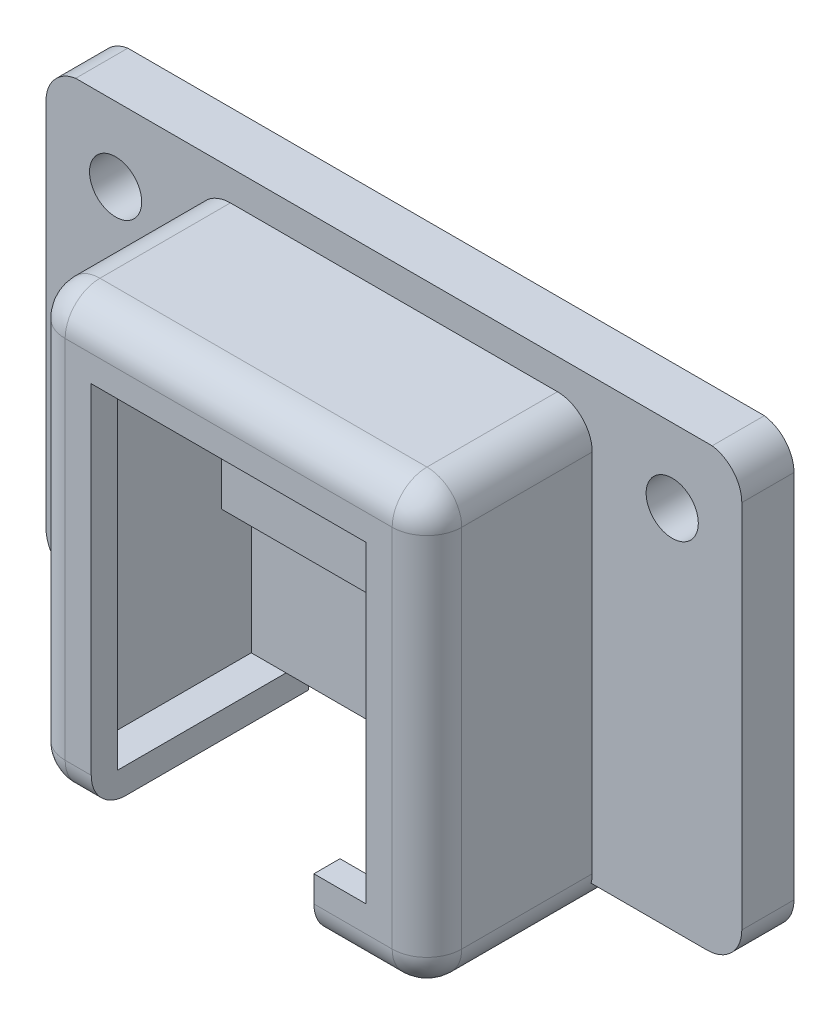
from build123d import *

# Parameters (mm, degrees)
CROQUIS1_R              = 1.5
SALIENTE_EXTRUIR1_DEPTH = 3
SALIENTE_EXTRUIR2_DEPTH = 8
CROQUIS3_W              = 13
CROQUIS3_H              = 1.7
CORTAR_EXTRUIR1_DEPTH   = 8
CROQUIS5_W              = 3.5
CROQUIS5_H              = 11
CROQUIS5_W_2            = 6.5
SALIENTE_EXTRUIR3_DEPTH = 1.5
SALIENTE_EXTRUIR4_DEPTH = 1.5
REDONDEO1_R             = 2


with BuildPart() as part:
    # Croquis1 → Saliente-Extruir1 (new body)
    with BuildSketch(Plane.XY):
        with BuildLine():
            Line((-75.306602598, 17.959617496), (-75.306602598, -5.318007663))
            Line((-75.306602598, -5.318007663), (-35.306602598, -5.318007663))
            Line((-35.306602598, -5.318007663), (-35.306602598, 17.959617496))
            ThreePointArc((-35.306602598, 17.959617496), (-35.791122177, 19.26473017), (-37.009921692, 19.937490201))
            Line((-37.009921692, 19.937490201), (-73.603283504, 19.937490201))
            ThreePointArc((-73.603283504, 19.937490201), (-74.822083019, 19.26473017), (-75.306602598, 17.959617496))
        make_face()
        with Locations((-71.306602598, 15.681992337)):
            Circle(CROQUIS1_R, mode=Mode.SUBTRACT)
        with Locations((-39.306602598, 15.681992337)):
            Circle(CROQUIS1_R, mode=Mode.SUBTRACT)
    extrude(amount=SALIENTE_EXTRUIR1_DEPTH)

    # Croquis2 → Saliente-Extruir2 (add)
    with BuildSketch(Plane.XY.offset(3)):
        Polygon((-66.706602598, -5.318007663), (-65.206602598, -5.318007663), (-65.206602598, 16.681992337), (-45.406602598, 16.681992337), (-45.406602598, -5.318007663), (-43.906602598, -5.318007663), (-43.906602598, 18.181992337), (-66.706602598, 18.181992337), align=None)
    extrude(amount=SALIENTE_EXTRUIR2_DEPTH)

    # Croquis3 → Cortar-Extruir1 (cut)
    with BuildSketch(Plane.XZ.offset(5.318007663)):
        with Locations((-58.706602598, 2.15)):
            Rectangle(CROQUIS3_W, CROQUIS3_H)
    extrude(amount=-CORTAR_EXTRUIR1_DEPTH, mode=Mode.SUBTRACT)

    # Croquis5 → Saliente-Extruir3 (add)
    with BuildSketch(Plane.XZ.offset(5.318007663)):
        with Locations((-64.956602598, 5.5)):
            Rectangle(CROQUIS5_W, CROQUIS5_H)
        with Locations((-47.156602598, 5.5)):
            Rectangle(CROQUIS5_W_2, CROQUIS5_H)
    extrude(amount=SALIENTE_EXTRUIR3_DEPTH)

    # Croquis6 → Saliente-Extruir4 (add)
    with BuildSketch(Plane.XY.offset(11)):
        Polygon((-63.206602598, -5.318007663), (-63.206602598, -6.818007663), (-66.706602598, -6.818007663), (-66.706602598, 18.181992337), (-43.906602598, 18.181992337), (-43.906602598, -6.818007663), (-50.406602598, -6.818007663), (-50.406602598, -3.318007663), (-47.406602598, -3.318007663), (-47.406602598, 14.681992337), (-63.206602598, 14.681992337), align=None)
    extrude(amount=SALIENTE_EXTRUIR4_DEPTH)

    # Redondeo1
    # the kernel refuses this fillet: 2 mm, written as the material it takes off along each edge
    with BuildSketch(Plane(origin=(-45.906602598, -4.818007663, 10.5), x_dir=(1, 0, 0), z_dir=(0, 0, 1))) as redondeo1_piece_1_section:
        Polygon((0, 0), (REDONDEO1_R * 1.02, 0), (REDONDEO1_R * 1.02, -REDONDEO1_R * 1.02), (0, -REDONDEO1_R * 1.02), align=None)
    redondeo1_piece_1 = extrude(amount=REDONDEO1_R * 1.02, mode=Mode.PRIVATE)
    redondeo1_piece_1 = redondeo1_piece_1 - Plane(origin=(-45.906602598, -4.818007663, 10.5), x_dir=(-0.7071067811865477, 0.7071067811865474, 0), z_dir=(0, 0, 1)) * Sphere(REDONDEO1_R, mode=Mode.PRIVATE)
    add(redondeo1_piece_1, mode=Mode.SUBTRACT)
    with BuildSketch(Plane(origin=(-45.906602598, 16.181992337, 10.5), x_dir=(0, 1, 0), z_dir=(0, 0, 1))) as redondeo1_piece_2_section:
        Polygon((0, 0), (REDONDEO1_R * 1.02, 0), (REDONDEO1_R * 1.02, -REDONDEO1_R * 1.02), (0, -REDONDEO1_R * 1.02), align=None)
    redondeo1_piece_2 = extrude(amount=REDONDEO1_R * 1.02, mode=Mode.PRIVATE)
    redondeo1_piece_2 = redondeo1_piece_2 - Plane(origin=(-45.906602598, 16.181992337, 10.5), x_dir=(-0.7071067811865471, -0.7071067811865477, 0), z_dir=(0, 0, 1)) * Sphere(REDONDEO1_R, mode=Mode.PRIVATE)
    add(redondeo1_piece_2, mode=Mode.SUBTRACT)
    with BuildSketch(Plane(origin=(-64.706602598, 16.181992337, 10.5), x_dir=(0, 1, 0), z_dir=(0, 0, 1))) as redondeo1_piece_3_section:
        Polygon((0, 0), (REDONDEO1_R * 1.02, 0), (REDONDEO1_R * 1.02, REDONDEO1_R * 1.02), (0, REDONDEO1_R * 1.02), align=None)
    redondeo1_piece_3 = extrude(amount=REDONDEO1_R * 1.02, mode=Mode.PRIVATE)
    redondeo1_piece_3 = redondeo1_piece_3 - Plane(origin=(-64.706602598, 16.181992337, 10.5), x_dir=(0.7071067811865477, -0.7071067811865475, 0), z_dir=(0, 0, 1)) * Sphere(REDONDEO1_R, mode=Mode.PRIVATE)
    add(redondeo1_piece_3, mode=Mode.SUBTRACT)
    with BuildSketch(Plane(origin=(-64.706602598, -4.818007663, 10.5), x_dir=(-1, 0, 0), z_dir=(0, 0, 1))) as redondeo1_piece_4_section:
        Polygon((0, 0), (REDONDEO1_R * 1.02, 0), (REDONDEO1_R * 1.02, REDONDEO1_R * 1.02), (0, REDONDEO1_R * 1.02), align=None)
    redondeo1_piece_4 = extrude(amount=REDONDEO1_R * 1.02, mode=Mode.PRIVATE)
    redondeo1_piece_4 = redondeo1_piece_4 - Plane(origin=(-64.706602598, -4.818007663, 10.5), x_dir=(0.7071067811865475, 0.7071067811865475, 0), z_dir=(0, 0, 1)) * Sphere(REDONDEO1_R, mode=Mode.PRIVATE)
    add(redondeo1_piece_4, mode=Mode.SUBTRACT)
    with BuildSketch(Plane(origin=(-35.306602598, -5.318007663, -5), x_dir=(-1, 0, 0), z_dir=(0, 0, 1))) as redondeo1_piece_5:
        with BuildLine():
            CenterArc((REDONDEO1_R, -REDONDEO1_R), REDONDEO1_R, 90, 90)
            Line((0, -REDONDEO1_R), (0, 0))
            Line((0, 0), (REDONDEO1_R, 0))
        make_face()
    extrude(amount=13, mode=Mode.SUBTRACT)
    with BuildSketch(Plane(origin=(-45.906602598, -6.818007663, 12.5), x_dir=(0, 0, -1), z_dir=(-1, 0, 0))) as redondeo1_piece_6:
        with BuildLine():
            CenterArc((REDONDEO1_R, -REDONDEO1_R), REDONDEO1_R, 90, 90)
            Line((0, -REDONDEO1_R), (0, 0))
            Line((0, 0), (REDONDEO1_R, 0))
        make_face()
    extrude(amount=9.5, mode=Mode.SUBTRACT)
    with BuildSketch(Plane(origin=(-43.906602598, 16.181992337, 12.5), x_dir=(-1, 0, 0), z_dir=(0, -1, 0))) as redondeo1_piece_7:
        with BuildLine():
            CenterArc((REDONDEO1_R, REDONDEO1_R), REDONDEO1_R, 180, 90)
            Line((0, REDONDEO1_R), (0, 0))
            Line((0, 0), (REDONDEO1_R, 0))
        make_face()
    extrude(amount=21, mode=Mode.SUBTRACT)
    with BuildSketch(Plane(origin=(-64.706602598, 18.181992337, 12.5), x_dir=(0, -1, 0), z_dir=(1, 0, 0))) as redondeo1_piece_8:
        with BuildLine():
            CenterArc((REDONDEO1_R, REDONDEO1_R), REDONDEO1_R, 180, 90)
            Line((0, REDONDEO1_R), (0, 0))
            Line((0, 0), (REDONDEO1_R, 0))
        make_face()
    extrude(amount=18.8, mode=Mode.SUBTRACT)
    with BuildSketch(Plane(origin=(-75.306602598, -5.318007663, -5), x_dir=(1, 0, 0), z_dir=(0, 0, 1))) as redondeo1_piece_9:
        with BuildLine():
            CenterArc((REDONDEO1_R, REDONDEO1_R), REDONDEO1_R, 180, 90)
            Line((0, REDONDEO1_R), (0, 0))
            Line((0, 0), (REDONDEO1_R, 0))
        make_face()
    extrude(amount=13, mode=Mode.SUBTRACT)
    with BuildSketch(Plane(origin=(-66.706602598, -4.818007663, 12.5), x_dir=(0, 0, -1), z_dir=(0, 1, 0))) as redondeo1_piece_10:
        with BuildLine():
            CenterArc((REDONDEO1_R, -REDONDEO1_R), REDONDEO1_R, 90, 90)
            Line((0, -REDONDEO1_R), (0, 0))
            Line((0, 0), (REDONDEO1_R, 0))
        make_face()
    extrude(amount=21, mode=Mode.SUBTRACT)
    with BuildSketch(Plane(origin=(-58.206602598, -6.818007663, 12.5), x_dir=(0, 0, -1), z_dir=(-1, 0, 0))) as redondeo1_piece_11:
        with BuildLine():
            CenterArc((REDONDEO1_R, -REDONDEO1_R), REDONDEO1_R, 90, 90)
            Line((0, -REDONDEO1_R), (0, 0))
            Line((0, 0), (REDONDEO1_R, 0))
        make_face()
    extrude(amount=6.5, mode=Mode.SUBTRACT)
    with BuildSketch(Plane(origin=(-66.706602598, 18.181992337, 10.5), x_dir=(0, -1, 0), z_dir=(0, 0, -1))) as redondeo1_piece_12:
        with BuildLine():
            CenterArc((REDONDEO1_R, -REDONDEO1_R), REDONDEO1_R, 90, 90)
            Line((0, -REDONDEO1_R), (0, 0))
            Line((0, 0), (REDONDEO1_R, 0))
        make_face()
    extrude(amount=7.5, mode=Mode.SUBTRACT)
    with BuildSketch(Plane(origin=(-43.906602598, 18.181992337, 3), x_dir=(-1, 0, 0), z_dir=(0, 0, 1))) as redondeo1_piece_13:
        with BuildLine():
            CenterArc((REDONDEO1_R, REDONDEO1_R), REDONDEO1_R, 180, 90)
            Line((0, REDONDEO1_R), (0, 0))
            Line((0, 0), (REDONDEO1_R, 0))
        make_face()
    extrude(amount=7.5, mode=Mode.SUBTRACT)
    with BuildSketch(Plane(origin=(-66.706602598, -6.818007663, -5), x_dir=(0, 1, 0), z_dir=(0, 0, 1))) as redondeo1_piece_14_section:
        with BuildLine():
            CenterArc((REDONDEO1_R, -REDONDEO1_R), REDONDEO1_R, 90, 90)
            Line((0, -REDONDEO1_R), (0, 0))
            Line((0, 0), (REDONDEO1_R, 0))
        make_face()
    redondeo1_piece_14 = extrude(amount=15.5, mode=Mode.PRIVATE)
    redondeo1_piece_14 = split(redondeo1_piece_14, bisect_by=Plane(origin=(-66.254561414, -5.318007663, 1.5), z_dir=(0, -1, 0)), keep=Keep.TOP, mode=Mode.PRIVATE)
    add(redondeo1_piece_14, mode=Mode.SUBTRACT)
    with BuildSketch(Plane(origin=(-66.706602598, -6.818007663, -5), x_dir=(0, 1, 0), z_dir=(0, 0, 1))) as redondeo1_piece_15_section:
        with BuildLine():
            CenterArc((REDONDEO1_R, -REDONDEO1_R), REDONDEO1_R, 90, 90)
            Line((0, -REDONDEO1_R), (0, 0))
            Line((0, 0), (REDONDEO1_R, 0))
        make_face()
    redondeo1_piece_15 = extrude(amount=15.5, mode=Mode.PRIVATE)
    redondeo1_piece_15 = split(redondeo1_piece_15, bisect_by=Plane(origin=(-66.687603103, -5.193408024, 3), z_dir=(0, 0, 1)), keep=Keep.TOP, mode=Mode.PRIVATE)
    add(redondeo1_piece_15, mode=Mode.SUBTRACT)
    with BuildSketch(Plane(origin=(-43.906602598, -6.818007663, -5), x_dir=(-1, 0, 0), z_dir=(0, 0, 1))) as redondeo1_piece_16_section:
        with BuildLine():
            CenterArc((REDONDEO1_R, -REDONDEO1_R), REDONDEO1_R, 90, 90)
            Line((0, -REDONDEO1_R), (0, 0))
            Line((0, 0), (REDONDEO1_R, 0))
        make_face()
    redondeo1_piece_16 = extrude(amount=15.5, mode=Mode.PRIVATE)
    redondeo1_piece_16 = split(redondeo1_piece_16, bisect_by=Plane(origin=(-44.358643782, -5.318007663, 1.5), z_dir=(0, -1, 0)), keep=Keep.TOP, mode=Mode.PRIVATE)
    add(redondeo1_piece_16, mode=Mode.SUBTRACT)
    with BuildSketch(Plane(origin=(-43.906602598, -6.818007663, -5), x_dir=(-1, 0, 0), z_dir=(0, 0, 1))) as redondeo1_piece_17_section:
        with BuildLine():
            CenterArc((REDONDEO1_R, -REDONDEO1_R), REDONDEO1_R, 90, 90)
            Line((0, -REDONDEO1_R), (0, 0))
            Line((0, 0), (REDONDEO1_R, 0))
        make_face()
    redondeo1_piece_17 = extrude(amount=15.5, mode=Mode.PRIVATE)
    redondeo1_piece_17 = split(redondeo1_piece_17, bisect_by=Plane(origin=(-43.925602093, -5.193408024, 3), z_dir=(0, 0, 1)), keep=Keep.TOP, mode=Mode.PRIVATE)
    add(redondeo1_piece_17, mode=Mode.SUBTRACT)


solid = part.part
